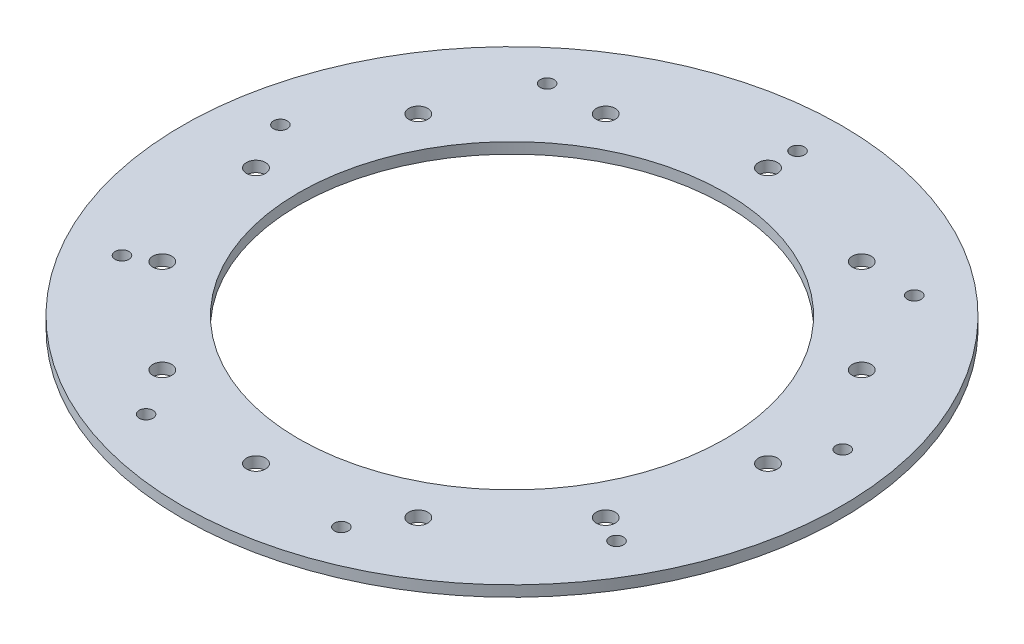
from build123d import *

# Parameters (mm, degrees)
SKETCH1_R           = 76.182
SKETCH1_R_2         = 49.3
BOSS_EXTRUDE1_DEPTH = 2.5
SKETCH2_R           = 1.6
CUT_EXTRUDE1_DEPTH  = 108.766619359
SKETCH3_R           = 2.2
CUT_EXTRUDE2_DEPTH  = 108.766619359
CIRPATTERN1_COUNT   = 9


with BuildPart() as part:
    # Sketch1 → Boss-Extrude1 (new body)
    with BuildSketch(Plane(origin=(0, 0, 0), x_dir=(1, 0, 0), z_dir=(0, 1, 0))):
        Circle(SKETCH1_R)
        Circle(SKETCH1_R_2, mode=Mode.SUBTRACT)
    extrude(amount=BOSS_EXTRUDE1_DEPTH)

    # Sketch2 → Cut-Extrude1 (cut, through all)
    with BuildSketch(Plane(origin=(0, 2.5, 0), x_dir=(1, 0, 0), z_dir=(0, 1, 0))):
        with Locations((0, 66)):
            Circle(SKETCH2_R)
    cut_extrude1 = extrude(amount=-CUT_EXTRUDE1_DEPTH, mode=Mode.SUBTRACT)

    # Sketch3 → Cut-Extrude2 (cut, through all)
    with BuildSketch(Plane(origin=(0, 2.5, 0), x_dir=(1, 0, 0), z_dir=(0, 1, 0))):
        with Locations((0, 59.18)):
            Circle(SKETCH3_R)
        with Locations((29.59, 51.251383396)):
            Circle(SKETCH3_R)
        with Locations((51.251383396, 29.59)):
            Circle(SKETCH3_R)
        with Locations((59.18, 0)):
            Circle(SKETCH3_R)
        with Locations((51.251383396, -29.59)):
            Circle(SKETCH3_R)
        with Locations((29.59, -51.251383396)):
            Circle(SKETCH3_R)
        with Locations((0, -59.18)):
            Circle(SKETCH3_R)
        with Locations((-29.59, -51.251383396)):
            Circle(SKETCH3_R)
        with Locations((-51.251383396, -29.59)):
            Circle(SKETCH3_R)
        with Locations((-59.18, 0)):
            Circle(SKETCH3_R)
        with Locations((-51.251383396, 29.59)):
            Circle(SKETCH3_R)
        with Locations((-29.59, 51.251383396)):
            Circle(SKETCH3_R)
    extrude(amount=-CUT_EXTRUDE2_DEPTH, mode=Mode.SUBTRACT)

    # CirPattern1: Cut-Extrude1 ×9 about axis
    cirpattern1_axis = Axis((0, 2.5, 0), (0, -1, 0))
    for i in range(1, CIRPATTERN1_COUNT):
        add(cut_extrude1.rotate(cirpattern1_axis, i * 360 / CIRPATTERN1_COUNT), mode=Mode.SUBTRACT)


solid = part.part
